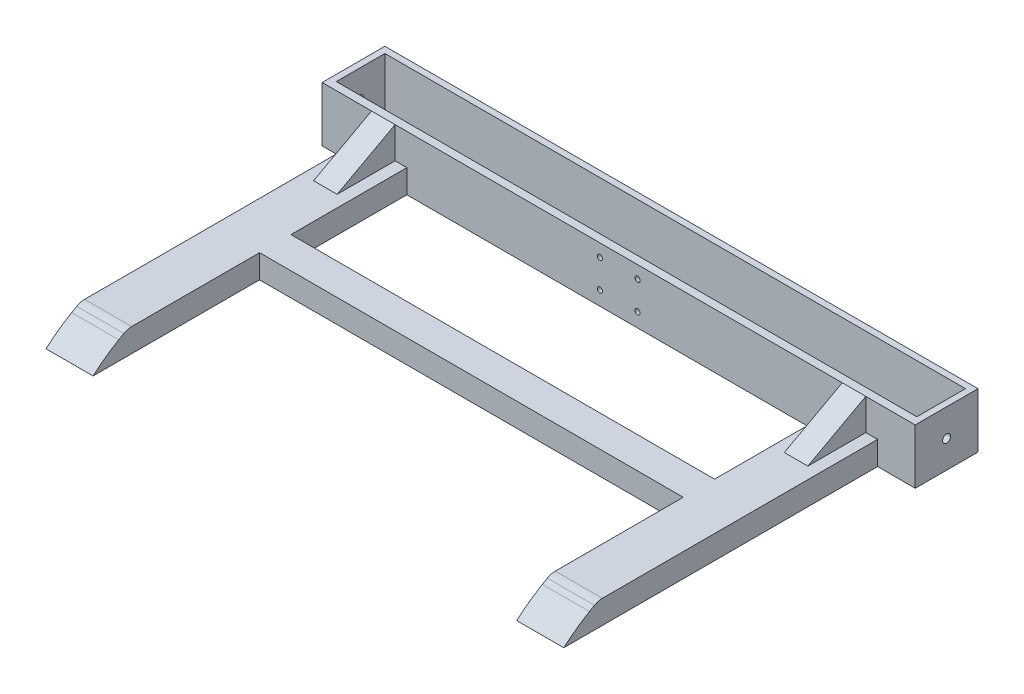
from build123d import *

# Parameters (mm, degrees)
SKETCH_1_W               = 378
SKETCH_1_H               = 35
EXTRUDE_1_DEPTH          = 2.5
SKETCH_3_W               = 4
SKETCH_3_H               = 35
EXTRUDE_2_DEPTH          = 35
SKETCH_4_R               = 2.55
CUT_EXTRUDE_3_DEPTH      = 382.464611727
HOLE_WIZARD_M4_6_D       = 3.3
SKETCH_6_W               = 30
SKETCH_6_H               = 15
EXTRUDE_3_DEPTH          = 200
EXTRUDE_4_REACH          = 385.676
SKETCH_15_W              = 20
SKETCH_15_H              = 15
EXTRUDE_5_REACH          = 428.74
SKETCH_17_W              = 4
SKETCH_17_H              = 35
SKETCH_18_W              = 4
SKETCH_18_H              = 35
EXTRUDE_6_DEPTH          = 185
CUT_EXTRUDE_4_DEPTH      = 410.325359586
CUT_EXTRUDE_4_DEPTH_BACK = 410.325359586
FILLET_1_R               = 100
FILLET_2_R               = 10
RIB_6_REACH              = 398.424
SKETCH_20_WALL_W         = 836.856433298
SKETCH_20_WALL_H         = 15


with BuildPart() as part:
    # 草图1 → 凸台-拉伸1 (new, symmetric)
    with BuildSketch(Plane.XY):
        with Locations((0, 17.5)):
            Rectangle(SKETCH_1_W, SKETCH_1_H)
    extrude(amount=EXTRUDE_1_DEPTH, both=True)

    # 草图3 → 凸台-拉伸2 (add)
    with BuildSketch(Plane(origin=(0, 0, -2.5), x_dir=(-1, 0, 0), z_dir=(0, 0, -1))):
        with Locations((-187, 17.5)):
            Rectangle(SKETCH_3_W, SKETCH_3_H)
        with Locations((187, 17.5)):
            Rectangle(SKETCH_3_W, SKETCH_3_H)
    extrude(amount=EXTRUDE_2_DEPTH)

    # 草图4 → 切除-拉伸3 (cut, through all)
    with BuildSketch(Plane(origin=(189, 0, 0), x_dir=(0, 0, -1), z_dir=(1, 0, 0))):
        with Locations((17.5, 17.5)):
            Circle(SKETCH_4_R)
    extrude(amount=-CUT_EXTRUDE_3_DEPTH, mode=Mode.SUBTRACT)

    # M4 螺纹孔的螺纹孔钻头6 (through all)
    with Locations(Plane.XY.offset(2.5)):
        with Locations((12, 27), (-12, 9), (-12, 27), (12, 9)):
            Hole(HOLE_WIZARD_M4_6_D / 2)

    # 草图6 → 凸台-拉伸3 (add)
    with BuildSketch(Plane.XY.offset(2.5)):
        with Locations((-150, 7.5)):
            Rectangle(SKETCH_6_W, SKETCH_6_H)
        with Locations((150, 7.5)):
            Rectangle(SKETCH_6_W, SKETCH_6_H)
    extrude(amount=EXTRUDE_3_DEPTH)

    # 草图15 → 凸台-拉伸4 (add, up to next)
    with BuildSketch(Plane(origin=(-135, 0, 0), x_dir=(0, 0, -1), z_dir=(1, 0, 0)), mode=Mode.PRIVATE) as extrude_4_sk1:
        with Locations((-86.382417222, 7.5)):
            Rectangle(SKETCH_15_W, SKETCH_15_H)
    extrude_4_tool1 = extrude(extrude_4_sk1.sketch, amount=EXTRUDE_4_REACH, mode=Mode.PRIVATE) - part.part
    add(extrude_4_tool1.solids().sort_by_distance((-135, 7.5, 86.382417))[0])

    # 草图17 → 凸台-拉伸5 (add, up to next)
    with BuildSketch(Plane.ZY.offset(-185), mode=Mode.PRIVATE) as extrude_5_sk1:
        with Locations((-35.5, 17.5)):
            Rectangle(SKETCH_17_W, SKETCH_17_H)
    extrude_5_tool1 = extrude(extrude_5_sk1.sketch, amount=EXTRUDE_5_REACH, mode=Mode.PRIVATE) - part.part
    add(extrude_5_tool1.solids().sort_by_distance((185, 17.5, -35.5))[0])

    # 草图18 → 凸台-拉伸6 (add)
    with BuildSketch(Plane(origin=(-185, 0, 0), x_dir=(0, 0, -1), z_dir=(1, 0, 0))):
        with Locations((35.5, 17.5)):
            Rectangle(SKETCH_18_W, SKETCH_18_H)
    extrude(amount=EXTRUDE_6_DEPTH)

    # 草图19 → 切除-拉伸4 (cut, two sides: drawn at the far end of the back side and taken through both)
    with BuildSketch(Plane.ZY.offset(165).offset(-CUT_EXTRUDE_4_DEPTH_BACK)):
        Polygon((-247.587382518, 262.210386508), (180.593567073, 15), (202.5, 2.352315052), (630.680949591, -244.858071456), (1125.101722607, 611.503827726), (246.833390498, 1118.57228569), align=None)
    extrude(amount=CUT_EXTRUDE_4_DEPTH + CUT_EXTRUDE_4_DEPTH_BACK, mode=Mode.SUBTRACT)

    # 圆角1
    # the kernel refuses this fillet: 100 mm, written as the material it takes off along each edge
    with BuildSketch(Plane(origin=(-212.264366854, 2.352315052, 202.5), x_dir=(0, -1, 0), z_dir=(1, 0, 0)), Plane(origin=(87.735633146, 2.352315052, 202.5), x_dir=(0, -1, 0), z_dir=(1, 0, 0))) as fillet_1_piece_1:
        with BuildLine():
            CenterArc((77.149667008, 66.372856956), FILLET_1_R, 210, 11.584858497)
            Line((-9.452873371, 16.372856956), (-11.184924178, 15.372856956))
            Line((-11.184924178, 15.372856956), (-1.732050808, -1))
            Line((-1.732050808, -1), (0, -2))
            ThreePointArc((0, -2), (1.176157526, -2), (0.856368013, -1.327457139))
            Line((0.856368013, -1.327457139), (2.352315052, 0))
        make_face()
    extrude(amount=124.528733709, mode=Mode.SUBTRACT)

    # 圆角2
    fillet_2_edges = [part.edges().sort_by_distance(p)[0] for p in [
        (150, 15, 180.593567073),
        (-150, 15, 180.593567073),
    ]]
    fillet(fillet_2_edges, radius=FILLET_2_R)

    # 草图20 wall → 筋6 (add, up to next)
    with BuildSketch(Plane(origin=(150, 25, 20.970604306), x_dir=(0, -0.476102376571, 0.879389860655), z_dir=(0, -0.879389860655, -0.476102376571)), mode=Mode.PRIVATE) as rib_6_sk1:
        Rectangle(SKETCH_20_WALL_W, SKETCH_20_WALL_H)
    rib_6_tool1 = extrude(rib_6_sk1.sketch, amount=RIB_6_REACH, mode=Mode.PRIVATE) - part.part
    rib_6 = rib_6_tool1.solids().sort_by_distance((150, 25, 20.970604306))[0]
    add(rib_6)

    # 镜向1: 筋6 across plane
    add(rib_6.mirror(Plane(origin=(0, 0, 0), x_dir=(0, 0, 1), z_dir=(1, 0, 0))))


solid = part.part
